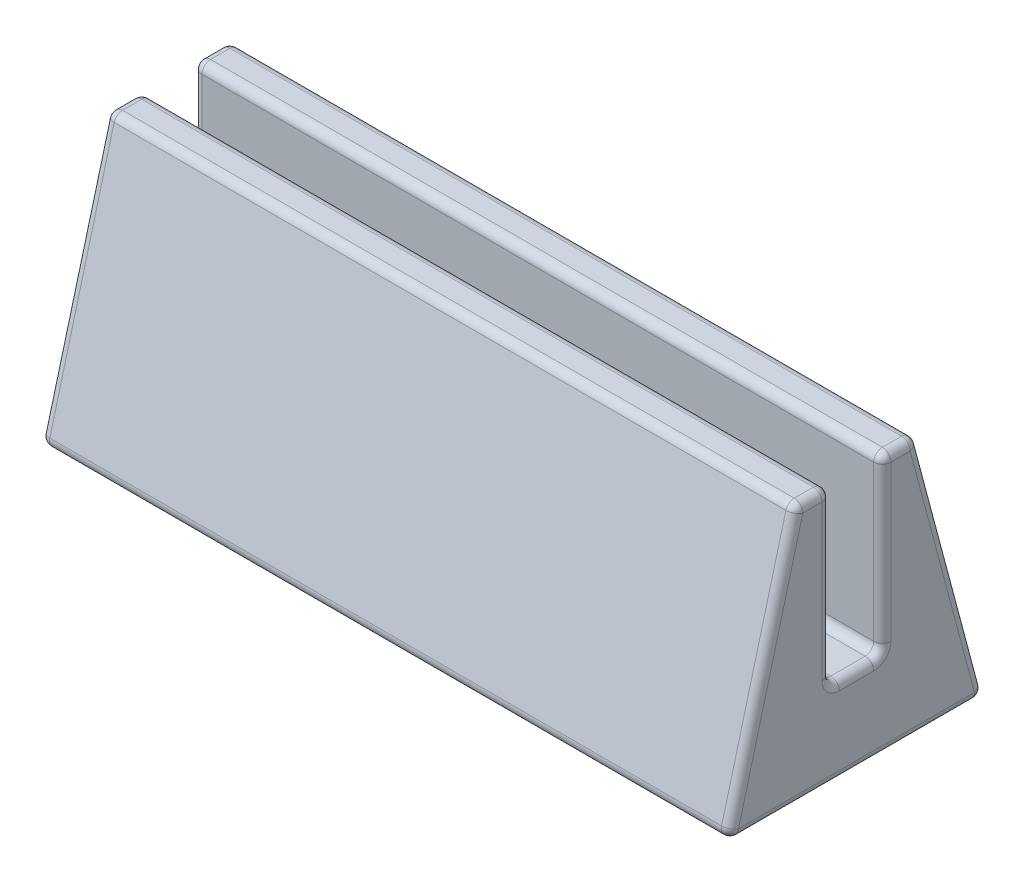
from build123d import *

# Parameters (mm, degrees)
BOSS_EXTRUDE1_DEPTH = 40
FILLET1_R           = 1


with BuildPart() as part:
    # Sketch1 → Boss-Extrude1 (new, symmetric)
    with BuildSketch(Plane(origin=(0, 0, 0), x_dir=(0, 0, -1), z_dir=(1, 0, 0))):
        Polygon((-15, 0), (15, 0), (7, 30), (3, 30), (3, 10), (-3, 10), (-3, 30), (-7, 30), align=None)
    extrude(amount=BOSS_EXTRUDE1_DEPTH, both=True)

    # Fillet1
    fillet1_edges = [part.edges().sort_by_distance(p)[0] for p in [
        (0, 10, 3),
        (0, 30, 3),
        (0, 30, 7),
        (0, 0, 15),
        (0, 0, -15),
        (0, 30, -7),
        (0, 30, -3),
        (0, 10, -3),
        (40, 20, -3),
        (40, 30, -5),
        (40, 15, -11),
        (40, 0, 0),
        (40, 15, 11),
        (40, 30, 5),
        (40, 20, 3),
        (40, 10, 0),
        (-40, 20, -3),
        (-40, 30, -5),
        (-40, 15, -11),
        (-40, 0, 0),
        (-40, 15, 11),
        (-40, 30, 5),
        (-40, 20, 3),
        (-40, 10, 0),
    ]]
    fillet(fillet1_edges, radius=FILLET1_R)


solid = part.part
